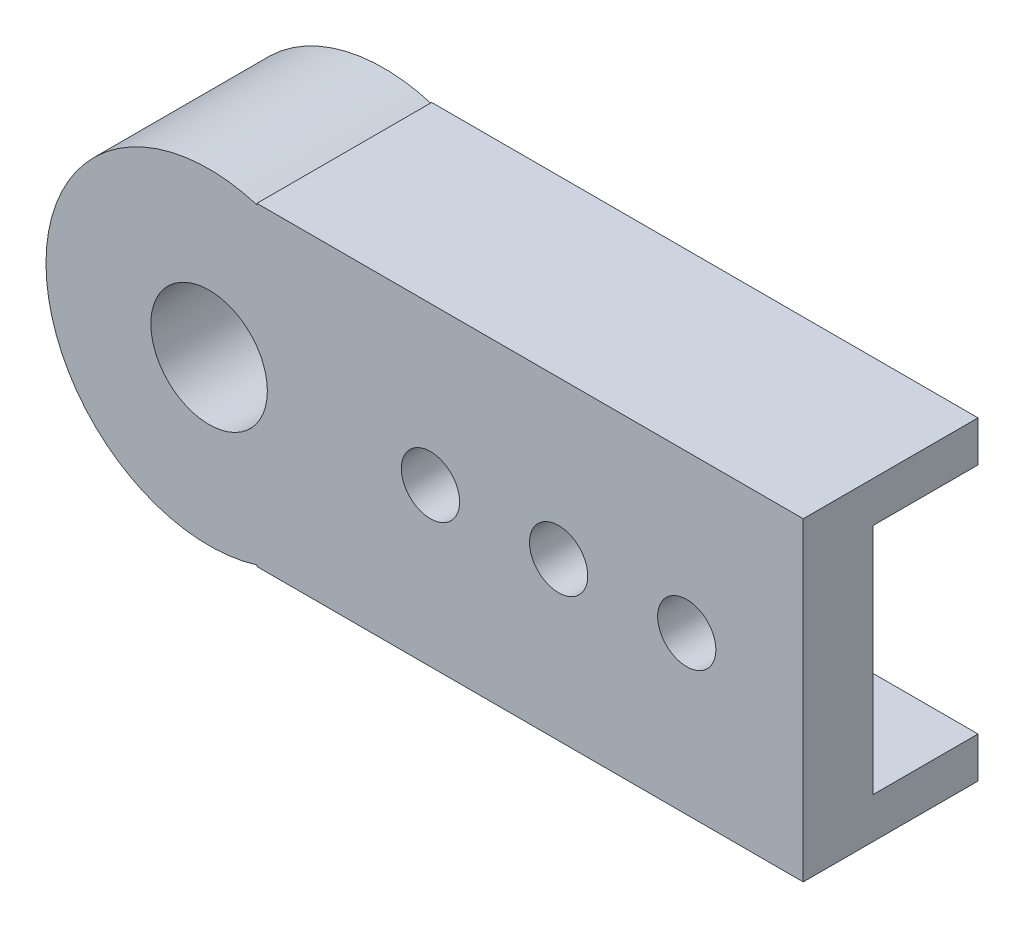
from build123d import *

# Parameters (mm, degrees)
SKETCH_1_W          = 40
SKETCH_1_H          = 20
EXTRUDE_1_DEPTH     = 6
SKETCH_2_R          = 2.5
CUT_EXTRUDE_1_DEPTH = 24.151673806
SKETCH_3_R          = 11
EXTRUDE_2_DEPTH     = 15
SKETCH_6_R          = 11
SKETCH_6_R_2        = 5
EXTRUDE_3_DEPTH     = 8


with BuildPart() as part:
    # 草图1 → 凸台-拉伸1 (new body)
    with BuildSketch(Plane.XY):
        Rectangle(SKETCH_1_W, SKETCH_1_H)
    extrude(amount=EXTRUDE_1_DEPTH)

    # 草图2 → 切除-拉伸1 (cut, through all)
    with BuildSketch(Plane.XY.offset(6)):
        with Locations((10, 0)):
            Circle(SKETCH_2_R)
        with Locations((-1, 0)):
            Circle(SKETCH_2_R)
        with Locations((-12, 0)):
            Circle(SKETCH_2_R)
    extrude(amount=-CUT_EXTRUDE_1_DEPTH, mode=Mode.SUBTRACT)

    # 草图3 → 凸台-拉伸2 (add)
    with BuildSketch(Plane.XY.offset(6)):
        with BuildLine():
            Line((20, 10), (20, 13.5))
            Line((20, 13.5), (-26.893967141, 13.5))
            Line((-26.893967141, 13.5), (-26.893967141, 13.384337644))
            ThreePointArc((-26.893967141, 13.384337644), (-45, 0), (-26.893967141, -13.384337644))
            Line((-26.893967141, -13.384337644), (-26.893967141, -13.5))
            Line((-26.893967141, -13.5), (20, -13.5))
            Line((20, -13.5), (20, -10))
            Line((20, -10), (-20, -10))
            Line((-20, -10), (-20, -8.660254038))
            ThreePointArc((-20, -8.660254038), (-17, 0), (-20, 8.660254038))
            Line((-20, 8.660254038), (-20, 10))
            Line((-20, 10), (20, 10))
        make_face()
        with Locations((-31, 0)):
            Circle(SKETCH_3_R, mode=Mode.SUBTRACT)
    extrude(amount=-EXTRUDE_2_DEPTH)

    # 草图6 → 凸台-拉伸3 (add)
    with BuildSketch(Plane.XY.offset(6)):
        with Locations((-31, 0)):
            Circle(SKETCH_6_R)
        with Locations((-31, 0)):
            Circle(SKETCH_6_R_2, mode=Mode.SUBTRACT)
    extrude(amount=-EXTRUDE_3_DEPTH)


solid = part.part
